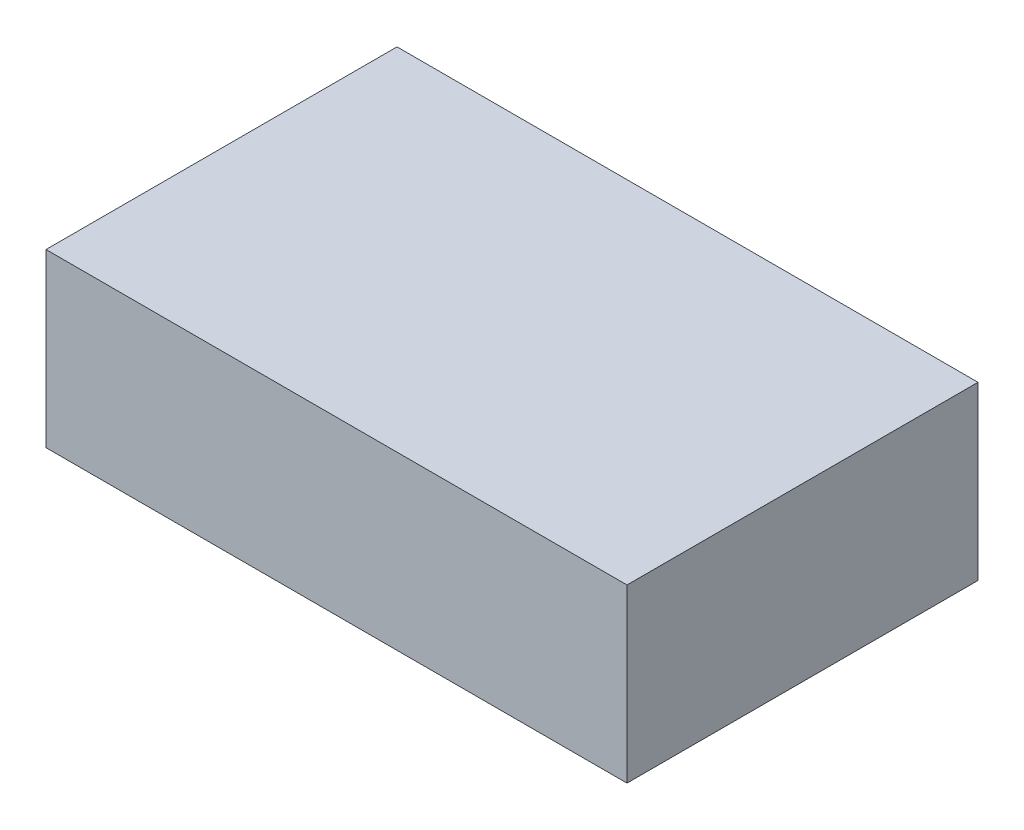
from build123d import *

# Parameters (mm, degrees)
SKETCH1_W           = 18
SKETCH1_H           = 13
SKETCH1_R           = 0.5
SKETCH1_R_2         = 1.5
BOSS_EXTRUDE1_DEPTH = 1.5
SKETCH2_W           = 18
SKETCH2_H           = 13
SKETCH2_W_2         = 5.077229708
SKETCH2_H_2         = 3.067324783
CUT_EXTRUDE1_DEPTH  = 23.254213084


with BuildPart() as part:
    # Sketch1 → Boss-Extrude1 (new body)
    with BuildSketch(Plane(origin=(0, 0, 0), x_dir=(1, 0, 0), z_dir=(0, 1, 0))):
        with Locations((9, -6.5)):
            Rectangle(SKETCH1_W, SKETCH1_H)
        with Locations((1.38, -1.38)):
            Circle(SKETCH1_R, mode=Mode.SUBTRACT)
        with Locations((3.92, -1.38)):
            Circle(SKETCH1_R, mode=Mode.SUBTRACT)
        with Locations((6.46, -1.38)):
            Circle(SKETCH1_R, mode=Mode.SUBTRACT)
        with Locations((9, -1.38)):
            Circle(SKETCH1_R, mode=Mode.SUBTRACT)
        with Locations((11.54, -1.38)):
            Circle(SKETCH1_R, mode=Mode.SUBTRACT)
        with Locations((14.08, -1.38)):
            Circle(SKETCH1_R, mode=Mode.SUBTRACT)
        with Locations((16.62, -1.38)):
            Circle(SKETCH1_R, mode=Mode.SUBTRACT)
        with Locations((2.63, -10.37)):
            Circle(SKETCH1_R_2, mode=Mode.SUBTRACT)
    extrude(amount=-BOSS_EXTRUDE1_DEPTH)

    # Sketch2 → Cut-Extrude1 (cut, through all)
    with BuildSketch(Plane(origin=(0, 0, 0), x_dir=(1, 0, 0), z_dir=(0, 1, 0))):
        with Locations((9, -6.5)):
            Rectangle(SKETCH2_W, SKETCH2_H)
        with Locations((9.369954861, -10.033021679)):
            Rectangle(SKETCH2_W_2, SKETCH2_H_2, mode=Mode.SUBTRACT)
    extrude(amount=-CUT_EXTRUDE1_DEPTH, mode=Mode.SUBTRACT)


solid = part.part
